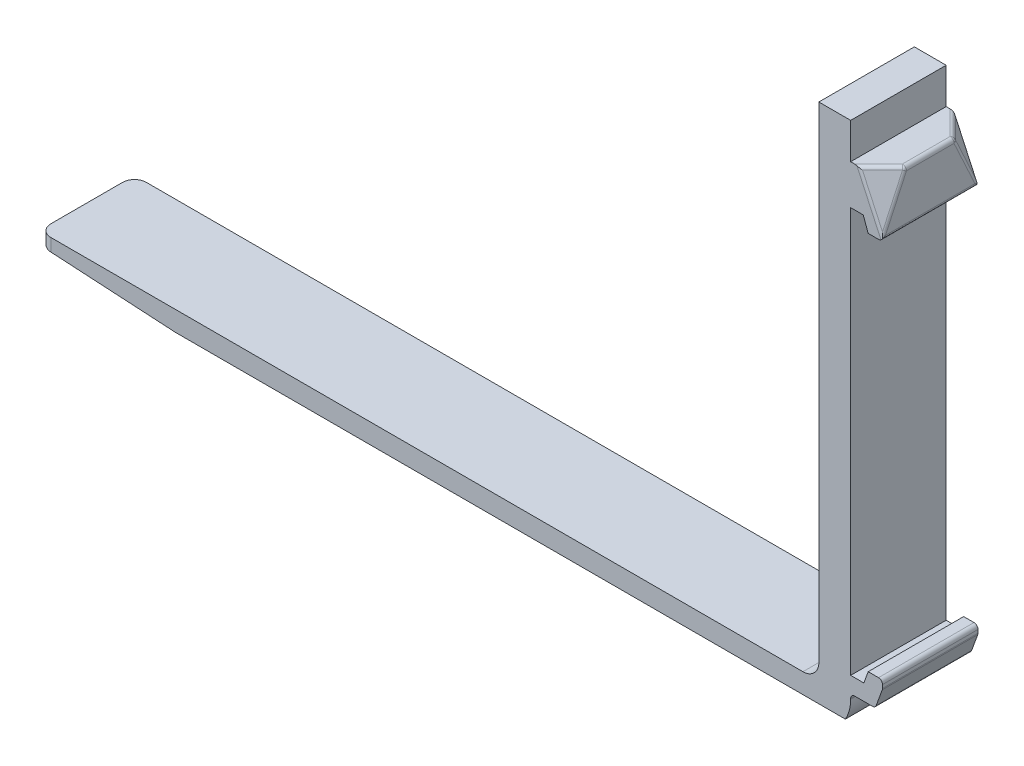
from build123d import *

# Parameters (mm, degrees)
BOSS_EXTRUDE1_DEPTH = 60
FILLET1_R           = 20
FILLET2_R           = 50
SKETCH2_W           = 848.571428571
SKETCH2_H           = 25
CUT_EXTRUDE1_DEPTH  = 1199.832765652
FILLET3_R           = 15
BOSS_EXTRUDE2_DEPTH = 60
CHAMFER1_START      = 59.982172039
CHAMFER1_OUTLINE_W  = 43
CHAMFER1_OUTLINE_H  = 75
CHAMFER1_DEPTH      = 21.017827961
CHAMFER2_START      = 59.982172039
CHAMFER2_OUTLINE_W  = 43
CHAMFER2_OUTLINE_H  = 75
CHAMFER2_DEPTH      = 21.017827961
FILLET4_R           = 5


with BuildPart() as part:
    # Sketch1 → Boss-Extrude1 (new, symmetric)
    with BuildSketch(Plane.XY):
        Polygon((0, 0), (0, -630), (-980, -630), (-980, -645), (-380, -680), (40, -680), (40, 0), align=None)
    extrude(amount=BOSS_EXTRUDE1_DEPTH, both=True)

    # Fillet1
    fillet1_edges = [part.edges().sort_by_distance(p)[0] for p in [
        (0, -630, 0),
    ]]
    fillet(fillet1_edges, radius=FILLET1_R)

    # Fillet2
    fillet2_edges = [part.edges().sort_by_distance(p)[0] for p in [
        (40, -680, 0),
    ]]
    fillet(fillet2_edges, radius=FILLET2_R)

    # Sketch2 → Cut-Extrude1 (cut, through all)
    with BuildSketch(Plane.XY.offset(60)):
        with Locations((-384.285714286, -667.5)):
            Rectangle(SKETCH2_W, SKETCH2_H)
    extrude(amount=-CUT_EXTRUDE1_DEPTH, mode=Mode.SUBTRACT)

    # Fillet3
    fillet3_edges = [part.edges().sort_by_distance(p)[0] for p in [
        (-980, -637.5, 60),
        (-980, -637.5, -60),
    ]]
    fillet(fillet3_edges, radius=FILLET3_R)

    # Sketch4 → Boss-Extrude2 (add, symmetric)
    with BuildSketch(Plane.XY):
        Polygon((40, -45), (80, -45), (80, -112), (62, -112), (55.812506017, -95), (40, -95), align=None)
        Polygon((40, -604), (56.540446486, -604), (62, -589), (80, -589), (80, -599), (70.900744143, -624), (40, -624), align=None)
    extrude(amount=BOSS_EXTRUDE2_DEPTH, both=True)

    # Chamfer1: read off the stored shape, not the designer's step
    # Chamfer1 outline → Chamfer1 (cut)
    with BuildSketch(Plane(origin=(0, 0, 0), x_dir=(0.74035690193716, -0.281696772444383, -0.6103430069628291), z_dir=(0.6722139969935248, 0.3102526139970119, 0.6722139969935248)).offset(CHAMFER1_START)):
        with Locations((33.5, -89.5)):
            Rectangle(CHAMFER1_OUTLINE_W, CHAMFER1_OUTLINE_H)
    extrude(amount=CHAMFER1_DEPTH, mode=Mode.SUBTRACT)

    # Chamfer2: read off the stored shape, not the designer's step
    # Chamfer2 outline → Chamfer2 (cut)
    with BuildSketch(Plane(origin=(0, 0, 0), x_dir=(0.74035690193716, -0.281696772444383, 0.6103430069628291), z_dir=(0.6722139969935248, 0.3102526139970119, -0.6722139969935248)).offset(CHAMFER2_START)):
        with Locations((33.5, 89.5)):
            Rectangle(CHAMFER2_OUTLINE_W, CHAMFER2_OUTLINE_H)
    extrude(amount=CHAMFER2_DEPTH, mode=Mode.SUBTRACT)

    # Fillet4
    # the kernel refuses this fillet: 5 mm, written as the material it adds along each edge
    with BuildSketch(Plane(origin=(40, -624, -60), x_dir=(1, 0, 0), z_dir=(0, 0, 1))) as fillet4_piece_1:
        with BuildLine():
            CenterArc((FILLET4_R, -FILLET4_R), FILLET4_R, 90, 90)
            Line((0, -FILLET4_R), (0, 0))
            Line((0, 0), (FILLET4_R, 0))
        make_face()
    extrude(amount=120)
    # the kernel refuses this fillet: 5 mm, written as the material it takes off along each edge
    with BuildSketch(Plane(origin=(75, -50, 29.869584766), x_dir=(0, 0.45647233632715695, -0.8897376052342775), z_dir=(0.7504731319703868, 0.5880284369504243, 0.30168300503707374))) as fillet4_2_piece_1_section:
        Polygon((-8.486724439, -8.486724439), (8.486724439, -8.486724439), (8.486724439, 8.486724439), (-8.486724439, 8.486724439), align=None)
    fillet4_2_piece_1 = extrude(amount=8.486724439, mode=Mode.PRIVATE)
    fillet4_2_piece_1 = split(fillet4_2_piece_1, bisect_by=Plane(origin=(75, -50, 29.869584766), z_dir=(0, 0.9079593845004515, -0.41905817746174745)), keep=Keep.TOP, mode=Mode.PRIVATE)
    fillet4_2_piece_1 = split(fillet4_2_piece_1, bisect_by=Plane(origin=(75, -50, 29.869584766), z_dir=(0.7071067811865476, 0, -0.7071067811865476)), keep=Keep.TOP, mode=Mode.PRIVATE)
    fillet4_2_piece_1 = split(fillet4_2_piece_1, bisect_by=Plane(origin=(75, -50, 29.869584766), z_dir=(0, 0, 1)), keep=Keep.TOP, mode=Mode.PRIVATE)
    fillet4_2_piece_1 = split(fillet4_2_piece_1, bisect_by=Plane(origin=(80, -50, 29.869584766), z_dir=(-1, 0, 0)), keep=Keep.TOP, mode=Mode.PRIVATE)
    fillet4_2_piece_1 = split(fillet4_2_piece_1, bisect_by=Plane(origin=(78.361069985, -48.44873693, 33.230654751), z_dir=(-0.6722139969935248, -0.3102526139970119, -0.6722139969935248)), keep=Keep.TOP, mode=Mode.PRIVATE)
    fillet4_2_piece_1 = split(fillet4_2_piece_1, bisect_by=Plane(origin=(75, -45, 29.869584766), z_dir=(0, -1, 0)), keep=Keep.TOP, mode=Mode.PRIVATE)
    fillet4_2_piece_1 = fillet4_2_piece_1 - Plane(origin=(75, -50, 29.869584766), x_dir=(-0.7504731319703868, -0.5880284369504243, -0.30168300503707374), z_dir=(0, 0.45647233632715695, -0.8897376052342775)) * Sphere(FILLET4_R, mode=Mode.PRIVATE)
    add(fillet4_2_piece_1, mode=Mode.SUBTRACT)
    with BuildSketch(Plane(origin=(75, -50, -29.869584766), x_dir=(-0.6608271381079537, 0.6608271381079537, -0.3558299974427439), z_dir=(0.7504731319703868, 0.5880284369504243, -0.30168300503707374))) as fillet4_2_piece_2_section:
        Polygon((-8.486724439, -8.486724439), (8.486724439, -8.486724439), (8.486724439, 8.486724439), (-8.486724439, 8.486724439), align=None)
    fillet4_2_piece_2 = extrude(amount=8.486724439, mode=Mode.PRIVATE)
    fillet4_2_piece_2 = split(fillet4_2_piece_2, bisect_by=Plane(origin=(75, -50, -29.869584766), z_dir=(0, 0.9079593845004515, 0.41905817746174745)), keep=Keep.TOP, mode=Mode.PRIVATE)
    fillet4_2_piece_2 = split(fillet4_2_piece_2, bisect_by=Plane(origin=(75, -50, -29.869584766), z_dir=(0, 0, -1)), keep=Keep.TOP, mode=Mode.PRIVATE)
    fillet4_2_piece_2 = split(fillet4_2_piece_2, bisect_by=Plane(origin=(75, -50, -29.869584766), z_dir=(0.7071067811865476, 0, 0.7071067811865476)), keep=Keep.TOP, mode=Mode.PRIVATE)
    fillet4_2_piece_2 = split(fillet4_2_piece_2, bisect_by=Plane(origin=(78.361069985, -48.44873693, -33.230654751), z_dir=(-0.6722139969935248, -0.3102526139970119, 0.6722139969935248)), keep=Keep.TOP, mode=Mode.PRIVATE)
    fillet4_2_piece_2 = split(fillet4_2_piece_2, bisect_by=Plane(origin=(80, -50, -29.869584766), z_dir=(-1, 0, 0)), keep=Keep.TOP, mode=Mode.PRIVATE)
    fillet4_2_piece_2 = split(fillet4_2_piece_2, bisect_by=Plane(origin=(75, -45, -29.869584766), z_dir=(0, -1, 0)), keep=Keep.TOP, mode=Mode.PRIVATE)
    fillet4_2_piece_2 = fillet4_2_piece_2 - Plane(origin=(75, -50, -29.869584766), x_dir=(-0.7504731319703868, -0.5880284369504243, 0.30168300503707374), z_dir=(-0.6608271381079537, 0.6608271381079537, -0.3558299974427439)) * Sphere(FILLET4_R, mode=Mode.PRIVATE)
    add(fillet4_2_piece_2, mode=Mode.SUBTRACT)
    with BuildSketch(Plane(origin=(82.319175466, -115.024880177, 60), x_dir=(-0.9079593845004514, -0.4190581774617474, 0), z_dir=(-0.41905817746174745, 0.9079593845004515, 0))) as fillet4_2_piece_3:
        with BuildLine():
            CenterArc((FILLET4_R * 0.4427405244, -FILLET4_R), FILLET4_R, 90, 47.761827017)
            Line((-FILLET4_R * 0.297616377538, -FILLET4_R * 0.327786003006), (0, 0))
            Line((0, 0), (FILLET4_R * 0.4427405244, 0))
        make_face()
    extrude(amount=82.657618428, mode=Mode.SUBTRACT)
    with BuildSketch(Plane(origin=(80, -45, 29.869584766), x_dir=(-1, 0, 0), z_dir=(0, 0, -1))) as fillet4_2_piece_4:
        with BuildLine():
            CenterArc((FILLET4_R, -FILLET4_R), FILLET4_R, 90, 90)
            Line((0, -FILLET4_R), (0, 0))
            Line((0, 0), (FILLET4_R, 0))
        make_face()
    extrude(amount=59.739169533, mode=Mode.SUBTRACT)
    with BuildSketch(Plane(origin=(80, -115.024880177, 62.319175466), x_dir=(0, -0.41905817746174745, -0.9079593845004515), z_dir=(0, 0.9079593845004515, -0.41905817746174745))) as fillet4_2_piece_5:
        with BuildLine():
            CenterArc((FILLET4_R * 0.4427405244, FILLET4_R), FILLET4_R, 222.238172983, 47.761827017)
            Line((-FILLET4_R * 0.297616377538, FILLET4_R * 0.327786003006), (0, 0))
            Line((0, 0), (FILLET4_R * 0.4427405244, 0))
        make_face()
    extrude(amount=72.63821652, mode=Mode.SUBTRACT)
    with BuildSketch(Plane(origin=(77.565207617, -45, 32.434792383), x_dir=(-0.7071067811865476, 0, -0.7071067811865476), z_dir=(-0.7071067811865476, 0, 0.7071067811865476)), Plane(origin=(43.586980958, -45, -66.413019041), x_dir=(-0.7071067811865476, 0, 0.7071067811865476), z_dir=(0.7071067811865476, 0, 0.7071067811865476))) as fillet4_2_piece_6:
        with BuildLine():
            CenterArc((FILLET4_R * 0.725550280312, FILLET4_R), FILLET4_R, 198.074454838, 71.925545162)
            Line((-FILLET4_R * 0.225103871053, FILLET4_R * 0.689747386003), (0, 0))
            Line((0, 0), (FILLET4_R * 0.725550280312, 0))
        make_face()
    extrude(amount=48.052468966, mode=Mode.SUBTRACT)
    with BuildSketch(Plane(origin=(80, -49.072329814, -31.879536837), x_dir=(-0.7403569019371568, 0.2816967724443845, -0.6103430069628323), z_dir=(0, -0.9079593845004515, -0.41905817746174745))) as fillet4_2_piece_7:
        with BuildLine():
            CenterArc((FILLET4_R * 0.4427405244, -FILLET4_R), FILLET4_R, 90, 47.761827017)
            Line((-FILLET4_R * 0.297616377538, -FILLET4_R * 0.327786003006), (0, 0))
            Line((0, 0), (FILLET4_R * 0.4427405244, 0))
        make_face()
    extrude(amount=72.63821652, mode=Mode.SUBTRACT)
    with BuildSketch(Plane(origin=(82.319175466, -115.024880177, -60), x_dir=(-0.9079593845004514, -0.4190581774617474, 0), z_dir=(-0.41905817746174745, 0.9079593845004515, 0))) as fillet4_2_piece_8:
        with BuildLine():
            CenterArc((FILLET4_R * 0.4427405244, FILLET4_R), FILLET4_R, 222.238172983, 47.761827017)
            Line((-FILLET4_R * 0.297616377538, FILLET4_R * 0.327786003006), (0, 0))
            Line((0, 0), (FILLET4_R * 0.4427405244, 0))
        make_face()
    extrude(amount=82.657618428, mode=Mode.SUBTRACT)
    with BuildSketch(Plane(origin=(80, -112, 72.5), x_dir=(0, 1, 0), z_dir=(0, 0, -1)), Plane(origin=(80, -589, 72.5), x_dir=(-1, 0, 0), z_dir=(0, 0, -1))) as fillet4_2_piece_9:
        with BuildLine():
            CenterArc((FILLET4_R, -FILLET4_R), FILLET4_R, 90, 90)
            Line((0, -FILLET4_R), (0, 0))
            Line((0, 0), (FILLET4_R, 0))
        make_face()
    extrude(amount=145, mode=Mode.SUBTRACT)
    with BuildSketch(Plane(origin=(70.900744143, -624, -68.752594228), x_dir=(0.34202014332566244, 0.9396926207859106, 0), z_dir=(0, 0, 1))) as fillet4_2_piece_10:
        with BuildLine():
            CenterArc((FILLET4_R * 0.70020753821, FILLET4_R), FILLET4_R, 200, 70)
            Line((-FILLET4_R * 0.239485082576, FILLET4_R * 0.657979856674), (0, 0))
            Line((0, 0), (FILLET4_R * 0.70020753821, 0))
        make_face()
    extrude(amount=137.505188455, mode=Mode.SUBTRACT)
    with BuildSketch(Plane(origin=(80, -599, 62.204087259), x_dir=(0, 1, 0), z_dir=(0, 0, -1))) as fillet4_2_piece_11:
        with BuildLine():
            CenterArc((FILLET4_R * 0.176326980708, -FILLET4_R), FILLET4_R, 90, 20)
            Line((-FILLET4_R * 0.165693162617, -FILLET4_R * 0.0603073792141), (0, 0))
            Line((0, 0), (FILLET4_R * 0.176326980708, 0))
        make_face()
    extrude(amount=124.408174518, mode=Mode.SUBTRACT)


solid = part.part
